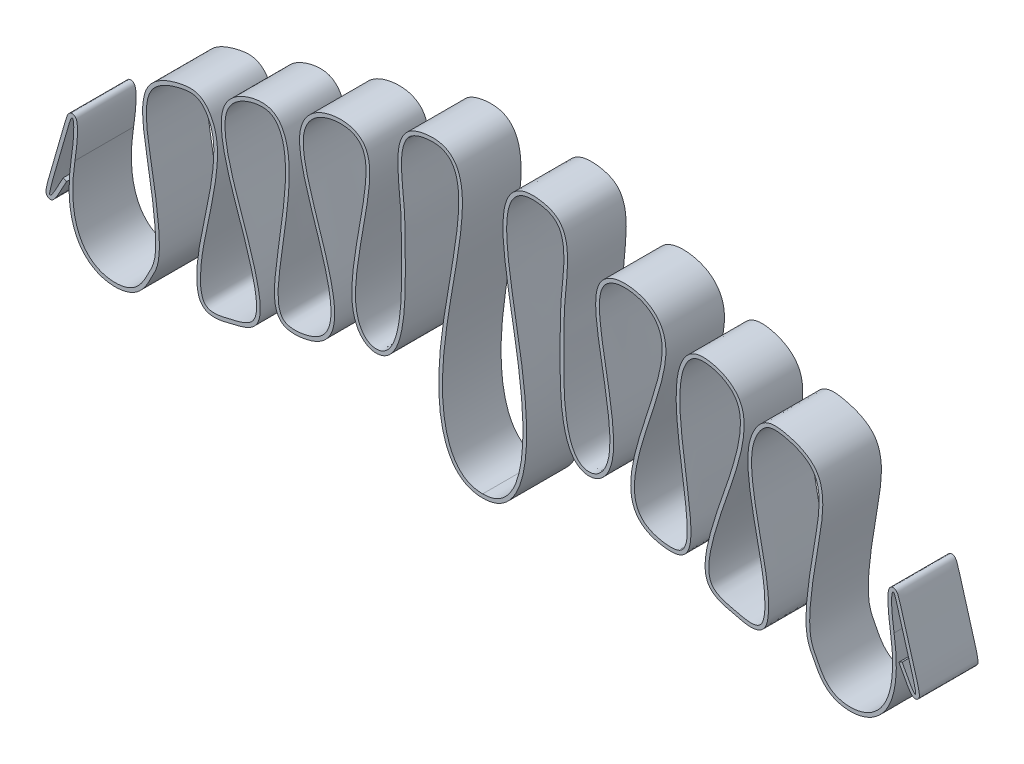
from build123d import *

# Parameters (mm, degrees)
EXTRUDE_THIN4_START = -6.35
EXTRUDE_THIN4_DEPTH = 12.7


# Read off the part's stored shape, not the designer's step: Extrude-Thin4
with BuildPart() as part:
    # Extrude-Thin4 outline → Extrude-Thin4 (new body)
    with BuildSketch(Plane.XY.offset(EXTRUDE_THIN4_START)):
        with BuildLine():
            add(Edge.make_bspline(
                [(-90.898222145, 14.676239099), (-95.265694725, 6.164230785), (-90.145268885, 23.415437486), (-88.808550095, 29.242237971), (-88.273671289, 25.038061748), (-91.841410077, 1.581291656), (-75.971206305, -2.878990027), (-70.836921038, 7.558636229), (-68.616385497, 10.94400883), (-74.489465603, 41.253985449), (-64.200462646, 44.938482962), (-60.773157971, 44.405752292), (-56.515985827, 36.081275138), (-62.144576369, 17.072096641), (-62.216975005, 3.674888213), (-49.129689955, 6.639899615), (-44.624156873, 8.169588501), (-59.288141095, 45.862180462), (-47.549166726, 50.56323788), (-42.93334144, 47.601679256), (-42.194838535, 38.189742685), (-45.008377663, 20.588265711), (-45.879308259, 9.891784578), (-29.800866952, 11.07298632), (-32.070071119, 24.59206724), (-41.75538758, 50.725375182), (-32.856644369, 55.741275408), (-24.543428341, 54.103531173), (-25.41762845, 43.459030546), (-30.79138226, 17.434789931), (-15.376362649, 11.474099205), (-17.123468095, 37.656377107), (-16.680313923, 44.5653522), (-18.52881079, 59.781053797), (2.266040275, 65.456959542), (-14.169012559, 25.33289141), (-7.5970833, 0), (0, 0)],
                knots=[0, 0, 0, 0, 0.132958813, 0.457181009, 1, 1, 2.662046225, 3.890517676, 5.811048531, 6.317848335, 6.707173886, 7.214493401, 7.55058587, 8.582243475, 9.276175105, 10.200889954, 12.794533833, 13.809803813, 14.414100829, 15.156897493, 16.402637278, 17.175185515, 18.075702585, 18.461905728, 20.486151375, 21.616848748, 22.850380448, 23.831930958, 25.089217089, 26.206076957, 27.967629729, 31.63381928, 32.714287443, 33.500135597, 33.760429587, 37.04186218, 38.766643999, 38.766643999, 38.766643999, 38.766643999], degree=3))
            Line((0, 0), (0, 0.8))
            add(Edge.make_bspline(
                [(0, 0.8), (-1.194788807, 0.8), (-2.213104084, 1.031719338), (-3.989556112, 1.87423261), (-4.753083462, 2.488178625), (-6.082553757, 4.08725254), (-6.64506189, 5.073804189), (-7.565227155, 7.366006856), (-7.922361185, 8.670337715), (-8.441437239, 11.517583413), (-8.603656104, 13.060235927), (-8.754335331, 16.305161833), (-8.742731428, 18.006783541), (-8.486222118, 23.241270792), (-8.023854671, 26.91195222), (-6.900057738, 34.221965744), (-6.238934236, 37.861280614), (-5.108084446, 44.732324733), (-4.637638733, 47.962725174), (-4.37419667, 52.243906535), (-4.359972359, 53.577262669), (-4.536822912, 56.023025106), (-4.726869627, 57.136335365), (-5.228617304, 58.617258189), (-5.432442245, 59.079407872), (-5.927176749, 59.930163818), (-6.21851098, 60.318759272), (-6.896664417, 61.002129055), (-7.283505712, 61.296244218), (-8.144686175, 61.769806503), (-8.618280772, 61.949129377), (-9.640808845, 62.188835423), (-10.189643364, 62.249711211), (-11.363365037, 62.256963956), (-11.986449534, 62.204051082), (-13.326280524, 61.982453164), (-14.053061799, 61.81051808), (-15.101077408, 61.376513727), (-15.443634181, 61.202061777), (-15.928021789, 60.880402215), (-16.085188972, 60.762444347), (-16.381850806, 60.50723728), (-16.520761974, 60.370996812), (-17.168942737, 59.653374682), (-17.536822581, 58.967079282), (-18.059475293, 57.487230897), (-18.216444783, 56.69045572), (-18.39762911, 55.044510966), (-18.421196278, 54.194746874), (-18.391024503, 52.503462822), (-18.337034799, 51.661958075), (-18.202250705, 50.055323206), (-18.121396347, 49.290050183), (-17.982315629, 47.911158673), (-17.923960991, 47.292027426), (-17.777019392, 45.609048017), (-17.71666262, 44.721301155), (-17.64297858, 43.234653886), (-17.629579021, 42.635902201), (-17.621995387, 41.537559285), (-17.627941006, 41.036677385), (-17.634097235, 39.40536532), (-17.611813762, 38.118591244), (-17.571409774, 35.299568511), (-17.554226644, 33.767969454), (-17.587601505, 30.626964528), (-17.638226687, 29.01757681), (-17.867411888, 25.893189268), (-18.046313876, 24.378001457), (-18.585813766, 21.622306422), (-18.948031682, 20.38218118), (-19.644963418, 18.871597474), (-19.902343668, 18.426624277), (-20.462109127, 17.671721894), (-20.763673067, 17.36216253), (-21.410380891, 16.878719811), (-21.757792308, 16.702798805), (-22.516853376, 16.481081573), (-22.922122342, 16.438126082), (-23.742595659, 16.510692442), (-24.15794557, 16.625440922), (-24.970469727, 17.043895688), (-25.368694668, 17.347903653), (-26.112625658, 18.197707694), (-26.458075918, 18.744433111), (-27.037232443, 20.13018019), (-27.270332338, 20.969082076), (-27.487137714, 22.471402525), (-27.537284383, 23.012734837), (-27.585723739, 24.17986116), (-27.583250171, 24.80873347), (-27.506285993, 26.807126773), (-27.362597061, 28.283861945), (-26.766472106, 32.905407706), (-26.149702407, 36.240335708), (-25.495080424, 39.986981878), (-25.370123688, 40.71503868), (-25.140920542, 42.113601431), (-25.036245943, 42.785409514), (-24.757800624, 44.720227093), (-24.619462372, 45.902428969), (-24.470351672, 48.064840858), (-24.459117545, 49.045071944), (-24.606489318, 50.823641682), (-24.764683664, 51.623921033), (-25.181909222, 52.693727352), (-25.351410359, 53.028168553), (-25.758601413, 53.644517527), (-25.996607238, 53.924739881), (-26.787652742, 54.664092777), (-27.417117996, 55.025002227), (-28.781831207, 55.515552131), (-29.518289402, 55.647362972), (-31.044305803, 55.724249755), (-31.833520893, 55.669430959), (-33.42412059, 55.396677599), (-34.233687146, 55.175537032), (-35.792977079, 54.507648473), (-36.543392567, 54.060026639), (-37.874065227, 52.881400954), (-38.452548063, 52.149103929), (-39.309402299, 50.383944326), (-39.586910209, 49.354051464), (-39.71610147, 47.587279977), (-39.709660342, 46.961440707), (-39.61430578, 45.655630876), (-39.526057867, 44.97390539), (-39.165121154, 42.856541368), (-38.796281733, 41.348166166), (-37.484617054, 36.680338165), (-36.335795485, 33.377005937), (-34.418360177, 27.304158507), (-33.641621299, 24.517945824), (-33.014184909, 20.861447673), (-32.894671938, 19.730266692), (-32.870180613, 17.673674571), (-32.965416461, 16.749387273), (-33.388271011, 15.12842323), (-33.712823305, 14.432599644), (-34.623482072, 13.235687121), (-35.211643526, 12.72934854), (-36.371616914, 12.102248584), (-36.804673005, 11.916147852), (-37.531106864, 11.675694743), (-37.78602651, 11.602008748), (-38.322285858, 11.468344174), (-38.604638617, 11.408005124), (-39.471844346, 11.255254624), (-40.076854859, 11.1919035), (-41.213926542, 11.183610536), (-41.745789296, 11.240636946), (-42.383831699, 11.419739553), (-42.566323477, 11.493185725), (-42.892653111, 11.67051268), (-43.036731988, 11.773869614), (-43.430967017, 12.133978466), (-43.646444602, 12.444101569), (-43.997327715, 13.238939143), (-44.128958238, 13.722069991), (-44.300456204, 14.831273092), (-44.340671494, 15.45623759), (-44.34839019, 17.485498969), (-44.202948654, 19.042261494), (-43.909392113, 21.492855643), (-43.800665138, 22.328607431), (-43.575683611, 24.011169709), (-43.458535944, 24.859435204), (-43.104741478, 27.402586691), (-42.865738073, 29.095714268), (-42.4435284, 32.359336092), (-42.261096725, 33.928807255), (-41.886032043, 38.289494939), (-41.850145373, 40.758943058), (-42.173036778, 43.87312095), (-42.343704867, 44.813279109), (-42.828926558, 46.508705564), (-43.143852988, 47.264723341), (-43.742528979, 48.257827107), (-43.965745015, 48.570530015), (-44.482712922, 49.143061921), (-44.776821593, 49.402206961), (-45.44508505, 49.83708853), (-45.818701463, 50.01194751), (-46.636908254, 50.257436587), (-47.080723078, 50.328510052), (-48.03848418, 50.365965369), (-48.552741604, 50.33281223), (-49.666752268, 50.161924139), (-50.274538771, 50.024046359), (-51.528140149, 49.617363335), (-52.172857975, 49.348680346), (-53.420679331, 48.648905347), (-54.024240229, 48.217456113), (-55.099026779, 47.156558752), (-55.569776794, 46.525781353), (-56.092666898, 45.420548596), (-56.234691717, 45.025554171), (-56.452259826, 44.204633874), (-56.529523805, 43.777001815), (-56.68114509, 42.450096181), (-56.675968356, 41.50658842), (-56.510577376, 39.530969058), (-56.349885344, 38.498675539), (-55.701629654, 35.31839364), (-55.047704142, 33.086001836), (-53.627819514, 28.709674818), (-52.86135605, 26.566072073), (-50.886728376, 20.783472473), (-50.006033182, 17.770633363), (-49.260313863, 14.244415027), (-49.107766699, 13.235160966), (-48.975843087, 11.511383467), (-48.996865035, 10.797710006), (-49.177806173, 9.624776475), (-49.335263279, 9.167219999), (-49.753854563, 8.416644669), (-50.015528074, 8.118102543), (-50.686093543, 7.586279636), (-51.098092136, 7.355683233), (-52.085823768, 6.940873542), (-52.659864215, 6.757656791), (-53.625860263, 6.494221978), (-53.965283826, 6.408167293), (-54.676280313, 6.234168099), (-55.051412369, 6.144201291), (-56.187897561, 5.879663896), (-56.961353244, 5.720410132), (-58.016945121, 5.641499624), (-58.350612719, 5.641675), (-58.957940235, 5.707185526), (-59.230579245, 5.772087317), (-59.709162982, 5.969648661), (-59.91607038, 6.10033501), (-60.291418075, 6.460655864), (-60.461213264, 6.691344401), (-60.759952885, 7.329510781), (-60.888291296, 7.741174751), (-61.076473638, 8.732159403), (-61.136907226, 9.3107638), (-61.207742115, 11.265147411), (-61.107661758, 12.858243146), (-60.746111667, 15.593954418), (-60.589417889, 16.564238768), (-60.215256361, 18.608320084), (-59.99993585, 19.679611486), (-59.317948794, 22.982694416), (-58.815230446, 25.303171821), (-57.975064496, 29.887866543), (-57.636976504, 32.151526794), (-57.455332411, 35.303653634), (-57.44904899, 36.314088821), (-57.550299123, 37.7476873), (-57.602543997, 38.211913419), (-57.749924523, 39.109597897), (-57.845745678, 39.54180479), (-58.188862754, 40.773780476), (-58.491451738, 41.51273504), (-59.01504708, 42.481409592), (-59.201239587, 42.781042177), (-59.591210013, 43.331413146), (-59.793880048, 43.581305409), (-60.218032786, 44.034288278), (-60.441311216, 44.238132466), (-60.918285613, 44.594852582), (-61.172076875, 44.747419162), (-61.708928001, 44.993801195), (-61.9915771, 45.087400478), (-62.579647398, 45.216321431), (-62.884851783, 45.251901813), (-63.835548725, 45.28353841), (-64.515542726, 45.206481991), (-65.659793831, 44.978724104), (-66.061651306, 44.885000886), (-66.923102871, 44.655052651), (-67.379029713, 44.51782585), (-68.775178353, 44.018294641), (-69.745176855, 43.569403087), (-71.06400749, 42.618916568), (-71.480716166, 42.255377048), (-72.040627502, 41.62715656), (-72.216327254, 41.403963726), (-72.539980909, 40.928808902), (-72.688262623, 40.675851455), (-73.080027404, 39.880669955), (-73.270386978, 39.309095424), (-73.543070633, 38.108859132), (-73.625508675, 37.479699956), (-73.751950375, 35.530249471), (-73.675805083, 34.146740328), (-73.369857381, 31.351104657), (-73.139053276, 29.939210198), (-72.789166966, 27.920323024), (-72.672405421, 27.265319506), (-72.453711992, 26.00386536), (-72.350368647, 25.395086), (-71.472499051, 20.105386255), (-71.064159399, 16.748444299), (-70.850561342, 13.041076269), (-70.845756898, 12.027111161), (-70.938320801, 10.327899046), (-71.035251955, 9.643403106), (-71.299829212, 8.473209202), (-71.466910074, 7.986499758), (-71.861226123, 7.058902703), (-72.090372709, 6.616905128), (-72.472599881, 5.892773581), (-72.605831833, 5.63895066), (-72.874605285, 5.130832643), (-73.012177919, 4.874846819), (-73.444910632, 4.112562075), (-73.760214202, 3.612299432), (-74.492160104, 2.686672564), (-74.907731226, 2.26151171), (-75.894842242, 1.529849157), (-76.466573758, 1.221727779), (-77.506964544, 0.883858656), (-77.885529527, 0.791993018), (-78.709483649, 0.660959852), (-79.152011018, 0.622536408), (-80.532994533, 0.612808845), (-81.523668399, 0.747318355), (-83.465731614, 1.409520074), (-84.417428967, 1.934880946), (-86.144012272, 3.505225404), (-86.922154271, 4.551867227), (-88.145112013, 7.346824), (-88.587859359, 9.096865301), (-88.931184894, 13.450645592), (-88.831055631, 16.053191406), (-88.156551081, 20.487848503), (-88.016508417, 21.667441914), (-87.842207088, 23.688687199), (-87.807685782, 24.529379035), (-87.819981107, 25.542215538), (-87.83466252, 25.838413485), (-87.886117981, 26.358234697), (-87.920847305, 26.579746533), (-88.007849577, 26.891042509), (-88.042252118, 26.991816551), (-88.121996602, 27.153068861), (-88.153484519, 27.208710304), (-88.236274715, 27.325658905), (-88.287688864, 27.38746928), (-88.427208608, 27.510029613), (-88.516875096, 27.571006945), (-88.736787732, 27.659394035), (-88.866683329, 27.683842836), (-89.115229495, 27.676375201), (-89.230739587, 27.646215393), (-89.419097086, 27.565727325), (-89.493625308, 27.516588344), (-89.676985711, 27.370352394), (-89.750872885, 27.274520666), (-89.877470766, 27.087168283), (-89.928028278, 26.993447658), (-90.072601243, 26.686563689), (-90.157634301, 26.451119341), (-90.371743894, 25.789494583), (-90.499174416, 25.36333213), (-90.831836922, 24.218642724), (-91.036806662, 23.500607581), (-91.556459337, 21.682604628), (-91.871101155, 20.582757834), (-92.448960798, 18.580931438), (-92.764360132, 17.492020821), (-93.12387542, 16.25887566), (-93.373845071, 15.403370353), (-93.505186522, 14.956155204), (-93.905121509, 13.584886199), (-94.173605836, 12.647743804), (-94.461274891, 11.472943031), (-94.538222906, 11.121152693), (-94.610817948, 10.661086531), (-94.628224106, 10.519390197), (-94.638628484, 10.308453787), (-94.639552392, 10.238279109), (-94.631187987, 10.087855852), (-94.622960837, 10.007893262), (-94.585979915, 9.862152583), (-94.569334318, 9.809006945), (-94.517546075, 9.690518123), (-94.482263514, 9.62464793), (-94.376598029, 9.486510353), (-94.304799477, 9.414125241), (-94.122441658, 9.294026198), (-94.0124139, 9.248748773), (-93.796409735, 9.205986504), (-93.692695211, 9.20729196), (-93.5169711, 9.232909314), (-93.443891856, 9.256207994), (-93.259165722, 9.332309743), (-93.178246127, 9.390015129), (-93.038686599, 9.50123409), (-92.981234612, 9.556961912), (-92.870404953, 9.674603184), (-92.817574788, 9.736612916), (-92.656241839, 9.938935581), (-92.544719601, 10.095889598), (-92.17204471, 10.660484299), (-91.873851895, 11.161798761), (-91.138587738, 12.484624798), (-90.702589804, 13.305092919), (-90.186447645, 14.311030855)],
                knots=[0, 0, 0, 0, 0.0078125, 0.0078125, 0.015625, 0.015625, 0.0234375, 0.0234375, 0.03125, 0.03125, 0.0390625, 0.0390625, 0.046875, 0.046875, 0.0625, 0.0625, 0.078125, 0.078125, 0.09375, 0.09375, 0.1015625, 0.1015625, 0.109375, 0.109375, 0.11328125, 0.11328125, 0.1171875, 0.1171875, 0.12109375, 0.12109375, 0.125, 0.125, 0.12890625, 0.12890625, 0.1328125, 0.1328125, 0.13671875, 0.13671875, 0.138671875, 0.138671875, 0.139648437, 0.139648437, 0.140625, 0.140625, 0.14453125, 0.14453125, 0.1484375, 0.1484375, 0.15234375, 0.15234375, 0.15625, 0.15625, 0.16015625, 0.16015625, 0.1640625, 0.1640625, 0.171875, 0.171875, 0.1796875, 0.1796875, 0.1875, 0.1875, 0.203125, 0.203125, 0.21875, 0.21875, 0.234375, 0.234375, 0.25, 0.25, 0.265625, 0.265625, 0.2734375, 0.2734375, 0.28125, 0.28125, 0.2890625, 0.2890625, 0.296875, 0.296875, 0.3046875, 0.3046875, 0.3125, 0.3125, 0.3203125, 0.3203125, 0.328125, 0.328125, 0.33203125, 0.33203125, 0.3359375, 0.3359375, 0.34375, 0.34375, 0.359375, 0.359375, 0.36328125, 0.36328125, 0.3671875, 0.3671875, 0.375, 0.375, 0.3828125, 0.3828125, 0.390625, 0.390625, 0.39453125, 0.39453125, 0.3984375, 0.3984375, 0.40625, 0.40625, 0.4140625, 0.4140625, 0.421875, 0.421875, 0.4296875, 0.4296875, 0.4375, 0.4375, 0.4453125, 0.4453125, 0.453125, 0.453125, 0.45703125, 0.45703125, 0.4609375, 0.4609375, 0.46875, 0.46875, 0.484375, 0.484375, 0.5, 0.5, 0.5078125, 0.5078125, 0.515625, 0.515625, 0.5234375, 0.5234375, 0.53125, 0.53125, 0.53515625, 0.53515625, 0.537109375, 0.537109375, 0.5390625, 0.5390625, 0.54296875, 0.54296875, 0.546875, 0.546875, 0.548828125, 0.548828125, 0.55078125, 0.55078125, 0.5546875, 0.5546875, 0.55859375, 0.55859375, 0.5625, 0.5625, 0.5703125, 0.5703125, 0.57421875, 0.57421875, 0.578125, 0.578125, 0.5859375, 0.5859375, 0.59375, 0.59375, 0.609375, 0.609375, 0.6171875, 0.6171875, 0.625, 0.625, 0.62890625, 0.62890625, 0.6328125, 0.6328125, 0.63671875, 0.63671875, 0.640625, 0.640625, 0.64453125, 0.64453125, 0.6484375, 0.6484375, 0.65234375, 0.65234375, 0.65625, 0.65625, 0.66015625, 0.66015625, 0.662109375, 0.662109375, 0.6640625, 0.6640625, 0.66796875, 0.66796875, 0.671875, 0.671875, 0.6796875, 0.6796875, 0.6875, 0.6875, 0.703125, 0.703125, 0.7109375, 0.7109375, 0.71875, 0.71875, 0.7265625, 0.7265625, 0.734375, 0.734375, 0.7421875, 0.7421875, 0.75, 0.75, 0.75390625, 0.75390625, 0.7578125, 0.7578125, 0.765625, 0.765625, 0.76953125, 0.76953125, 0.7734375, 0.7734375, 0.77734375, 0.77734375, 0.78125, 0.78125, 0.78515625, 0.78515625, 0.7890625, 0.7890625, 0.796875, 0.796875, 0.80078125, 0.80078125, 0.8046875, 0.8046875, 0.8125, 0.8125, 0.8203125, 0.8203125, 0.82421875, 0.82421875, 0.826171875, 0.826171875, 0.828125, 0.828125, 0.83203125, 0.83203125, 0.833984375, 0.833984375, 0.8359375, 0.8359375, 0.837890625, 0.837890625, 0.83984375, 0.83984375, 0.841796875, 0.841796875, 0.84375, 0.84375, 0.84765625, 0.84765625, 0.849609375, 0.849609375, 0.8515625, 0.8515625, 0.85546875, 0.85546875, 0.857421875, 0.857421875, 0.858398438, 0.858398438, 0.859375, 0.859375, 0.861328125, 0.861328125, 0.86328125, 0.86328125, 0.8671875, 0.8671875, 0.87109375, 0.87109375, 0.873046875, 0.873046875, 0.875, 0.875, 0.890625, 0.890625, 0.8984375, 0.8984375, 0.90625, 0.90625, 0.9140625, 0.9140625, 0.921875, 0.921875, 0.92578125, 0.92578125, 0.9296875, 0.9296875, 0.9375, 0.9375, 0.9453125, 0.9453125, 0.953125, 0.953125, 0.95703125, 0.95703125, 0.9609375, 0.9609375, 0.96875, 0.96875, 0.9765625, 0.9765625, 0.984375, 0.984375, 0.9921875, 0.9921875, 1, 1, 1.003400741, 1.003400741, 1.006801482, 1.006801482, 1.008501852, 1.008501852, 1.010202223, 1.010202223, 1.011052408, 1.011052408, 1.011477501, 1.011477501, 1.011902593, 1.011902593, 1.012327686, 1.012327686, 1.012752779, 1.012752779, 1.013177871, 1.013177871, 1.013602964, 1.013602964, 1.014453149, 1.014453149, 1.015303334, 1.015303334, 1.017003705, 1.017003705, 1.018704075, 1.018704075, 1.020404446, 1.020404446, 1.022104816, 1.022104816, 1.022955002, 1.023380094, 1.023380094, 1.023805187, 1.023805187, 1.024655372, 1.024655372, 1.025080465, 1.025080465, 1.025293011, 1.025293011, 1.025399284, 1.025399284, 1.025505557, 1.025505557, 1.025558694, 1.025558694, 1.02561183, 1.02561183, 1.025664967, 1.025664967, 1.025718104, 1.025718104, 1.02577124, 1.02577124, 1.025824377, 1.025824377, 1.02593065, 1.02593065, 1.026036923, 1.026036923, 1.026143196, 1.026143196, 1.026355743, 1.026355743, 1.026780835, 1.026780835, 1.027205928, 1.027205928, 1.027205928, 1.027205928], degree=3))
            Line((-90.186447645, 14.311030855), (-90.898222145, 14.676239099))
        make_face()
    extrude_thin4 = extrude(amount=EXTRUDE_THIN4_DEPTH)

    # Mirror1: Extrude-Thin4 across plane
    add(extrude_thin4.mirror(Plane(origin=(0, 0, 0), x_dir=(0, 0, 1), z_dir=(1, 0, 0))))


solid = part.part
